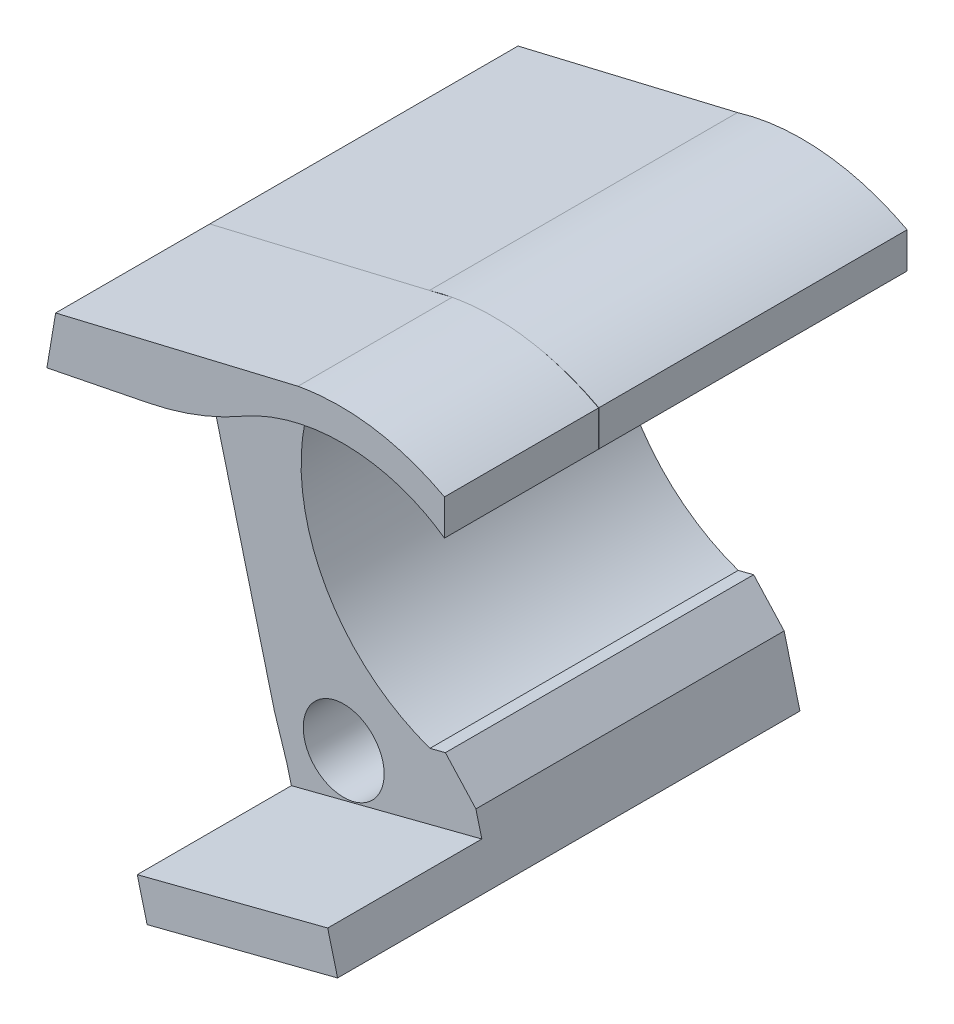
from build123d import *

# Parameters (mm, degrees)
ESQUISSE1_R        = 2.625
BOSS_EXTRU_1_DEPTH = 20
BOSS_EXTRU_2_DEPTH = 10
CONG_1_R           = 20


with BuildPart() as part:
    # Esquisse1 → Boss.-Extru.1 (new body)
    with BuildSketch(Plane.XY):
        with BuildLine():
            Line((-12.878360569, 6.515359117), (-8.020339377, -12.363190353))
            Line((-8.020339377, -12.363190353), (-7.184290041, -14.975749546))
            Line((-7.184290041, -14.975749546), (-6.273733273, -18.514225461))
            Line((-6.273733273, -18.514225461), (6.084139136, -15.334171498))
            Line((6.084139136, -15.334171498), (5.057924502, -11.346242467))
            Line((5.057924502, -11.346242467), (3.078875229, -9.174621187))
            Line((3.078875229, -9.174621187), (2.078875229, -9.431951402))
            ThreePointArc((2.078875229, -9.431951402), (-6.211369181, 1.027535241), (-0.332877148, 13.009703018))
            add(Edge.make_bspline(
                [(-0.332877148, 13.009703018), (3.635319831, 15.430088875), (9.061222384, 15.682810055), (13.036143443, 12.866520456)],
                knots=[0.137989148, 0.137989148, 0.137989148, 0.137989148, 1, 1, 1, 1], degree=3))
            Line((13.036143443, 12.866520456), (13.036143443, 15.184978364))
            ThreePointArc((13.036143443, 15.184978364), (7.640620829, 16.815579292), (2.030648386, 16.269014707))
            Line((2.030648386, 16.269014707), (-12.209553486, 12.887901937))
            Line((-12.209553486, 12.887901937), (-12.963968388, 8.407411627))
            ThreePointArc((-12.963968388, 8.407411627), (-13.021834037, 7.456830476), (-12.878360569, 6.515359117))
        make_face()
        with Locations((-8.526433179, 7.660229409)):
            Circle(ESQUISSE1_R, mode=Mode.SUBTRACT)
        with Locations((-3.520339377, -12.363190353)):
            Circle(ESQUISSE1_R, mode=Mode.SUBTRACT)
    extrude(amount=BOSS_EXTRU_1_DEPTH)

    # Esquisse2 → Boss.-Extru.2 (add)
    with BuildSketch(Plane.XY.offset(20)):
        with BuildLine():
            Line((3.515696045, 16.632060199), (-12.209553486, 12.887901937))
            Line((-12.209553486, 12.887901937), (-12.776590706, 9.520252701))
            Line((-12.776590706, 9.520252701), (-2.148750203, 11.650983572))
            add(Edge.make_bspline(
                [(-2.148750203, 11.650983572), (1.825462535, 15.250820675), (8.40154324, 16.121946302), (13.020339377, 12.849633253)],
                knots=[0, 0, 0, 0, 1, 1, 1, 1], degree=3))
            Line((13.020339377, 12.849633253), (13.020339377, 15.168091161))
            add(Edge.make_bspline(
                [(13.020339377, 15.168091161), (8.543548068, 17.54082168), (3.515696045, 16.632060199)],
                knots=[0, 0, 0, 1, 1, 1], degree=2))
        make_face()
        Polygon((-6.273733273, -18.514225461), (-6.914268997, -16.025066838), (5.443603413, -12.845012876), (6.084139136, -15.334171498), align=None)
    extrude(amount=BOSS_EXTRU_2_DEPTH)

    # Congé1
    # the kernel refuses this fillet: 20 mm, written as the material it takes off along each edge
    with BuildSketch(Plane(origin=(-2.148750203, 11.650983572, 20), x_dir=(0.8088209493644074, 0.5880549905147126, 0), z_dir=(0, 0, 1))) as cong_1_piece_1:
        with BuildLine():
            CenterArc((4.611497796, 19.891667354), CONG_1_R, 245.31758692, 18.716203056)
            Line((-3.740265961, 1.718939376), (-3.907301236, 1.355484817))
            Line((-3.907301236, 1.355484817), (-0.167035275, -0.36345456))
            Line((-0.167035275, -0.36345456), (0.042860615, -0.39769708))
            ThreePointArc((0.042860615, -0.39769708), (1.26605814, -0.333034673), (2.491082434, -0.397833347))
            Line((2.491082434, -0.397833347), (2.532659206, 0))
        make_face()
    extrude(amount=10, mode=Mode.SUBTRACT)


solid = part.part
